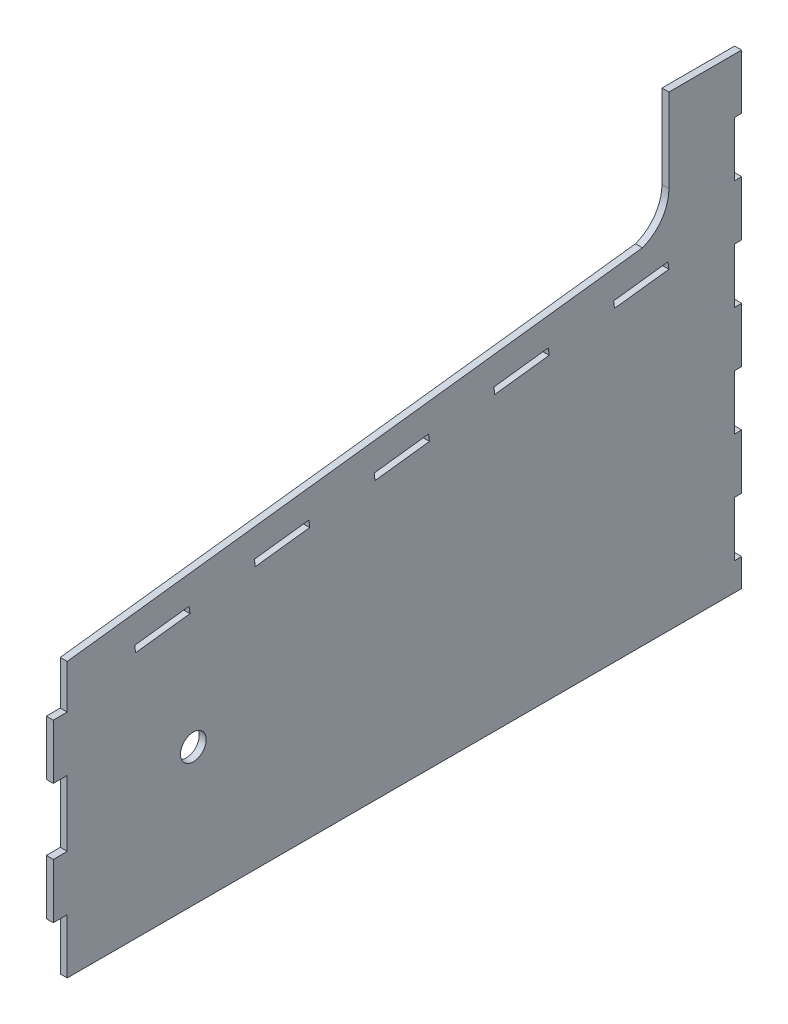
from build123d import *

# Parameters (mm, degrees)
BOSS_EXTRUDE1_DEPTH = 6.35
SKETCH2_R           = 11.735
SKETCH2_W           = 6.35
SKETCH2_H           = 50
CUT_EXTRUDE1_DEPTH  = 6.35


with BuildPart() as part:
    # Sketch1 → Boss-Extrude1 (new body)
    with BuildSketch(Plane(origin=(0, 0, 0), x_dir=(0, 0, -1), z_dir=(1, 0, 0))):
        with BuildLine():
            Line((0, 250), (524.529993531, 314.404184936))
            ThreePointArc((524.529993531, 314.404184936), (542.027292182, 327.966077076), (548.65, 349.09))
            Line((548.65, 349.09), (548.65, 425.32))
            Line((548.65, 425.32), (615, 425.32))
            Line((615, 425.32), (615, 0))
            Line((615, 0), (0, 0))
            Line((0, 0), (0, 50))
            Line((0, 50), (-12.7, 50))
            Line((-12.7, 50), (-12.7, 100))
            Line((-12.7, 100), (0, 100))
            Line((0, 100), (0, 160))
            Line((0, 160), (-12.7, 160))
            Line((-12.7, 160), (-12.7, 210))
            Line((-12.7, 210), (0, 210))
            Line((0, 210), (0, 250))
        make_face()
    extrude(amount=BOSS_EXTRUDE1_DEPTH)

    # Sketch2 → Cut-Extrude1 (cut)
    with BuildSketch(Plane(origin=(6.35, 0, 0), x_dir=(0, 0, -1), z_dir=(1, 0, 0))):
        with Locations((115, 125)):
            Circle(SKETCH2_R)
        Polygon((61.537861402, 231.965149724), (62.311731732, 225.662481662), (111.939039314, 231.755948832), (111.165168984, 238.058616895), align=None)
        Polygon((220.345245664, 251.464244669), (170.717938082, 245.370777499), (171.491808413, 239.068109436), (221.119115995, 245.161576606), align=None)
        Polygon((329.525322345, 264.869872444), (279.898014763, 258.776405274), (280.671885093, 252.473737211), (330.299192676, 258.567204381), align=None)
        Polygon((438.705399025, 278.275500218), (389.078091443, 272.182033048), (389.851961774, 265.879364985), (439.479269356, 271.972832155), align=None)
        Polygon((547.885475706, 291.681127993), (498.258168124, 285.587660823), (499.032038455, 279.28499276), (548.659346037, 285.37845993), align=None)
        with Locations((611.825, 350.32)):
            Rectangle(SKETCH2_W, SKETCH2_H)
        with Locations((611.825, 250.32)):
            Rectangle(SKETCH2_W, SKETCH2_H)
        with Locations((611.825, 150.32)):
            Rectangle(SKETCH2_W, SKETCH2_H)
        with Locations((611.825, 50.32)):
            Rectangle(SKETCH2_W, SKETCH2_H)
    extrude(amount=-CUT_EXTRUDE1_DEPTH, mode=Mode.SUBTRACT)


solid = part.part
